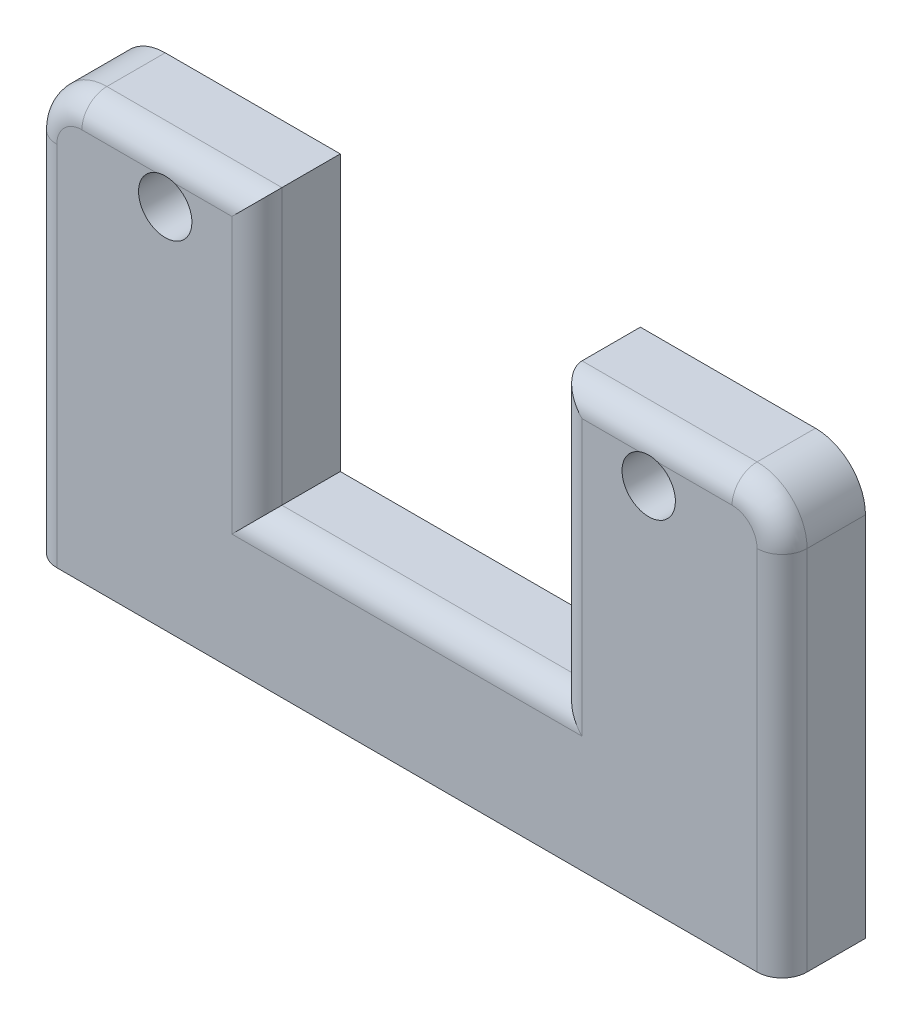
from build123d import *

# Parameters (mm, degrees)
MODEL_R             = 1.6
EXTRUDE_1_DEPTH     = 5
SKETCH_2_R          = 1.25
CUT_EXTRUDE_1_DEPTH = 6
FILLET_1_R          = 1.5


with BuildPart() as part:
    # Model → 凸台-拉伸1 (new body)
    with BuildSketch(Plane.XY):
        with BuildLine():
            Line((241.119901236, 237.095927438), (251.619901236, 237.095927438))
            Line((251.619901236, 237.095927438), (251.619901236, 220.595927438))
            Line((251.619901236, 220.595927438), (269.619901236, 220.595927438))
            Line((269.619901236, 220.595927438), (269.619901236, 237.095927438))
            Line((269.619901236, 237.095927438), (280.119901236, 237.095927438))
            ThreePointArc((280.119901236, 237.095927438), (282.241221579, 236.217247782), (283.119901236, 234.095927438))
            Line((283.119901236, 234.095927438), (283.119901236, 212.095927438))
            Line((283.119901236, 212.095927438), (238.119901236, 212.095927438))
            Line((238.119901236, 212.095927438), (238.119901236, 234.095927438))
            ThreePointArc((238.119901236, 234.095927438), (238.998580892, 236.217247782), (241.119901236, 237.095927438))
        make_face()
        with Locations((246.119901236, 234.095927438)):
            Circle(MODEL_R, mode=Mode.SUBTRACT)
        with Locations((275.119901236, 234.095927438)):
            Circle(MODEL_R, mode=Mode.SUBTRACT)
    extrude(amount=EXTRUDE_1_DEPTH)

    # 草图2 → 切除-拉伸1 (cut)
    with BuildSketch(Plane.XZ.offset(-212.095927438)):
        with Locations(Location((241.369901236, 2.5, 0), (0, 0, 270))):
            Circle(SKETCH_2_R)
        with Locations(Location((279.869901236, 2.5, 0), (0, 0, 270))):
            Circle(SKETCH_2_R)
    extrude(amount=-CUT_EXTRUDE_1_DEPTH, mode=Mode.SUBTRACT)

    # 圆角1
    # the kernel refuses this fillet: 1.5 mm, written as the material it takes off along each edge
    with BuildSketch(Plane(origin=(283.119901236, 234.095927438, 5), x_dir=(0, 0, -1), z_dir=(0, -1, 0))) as fillet_1_piece_1:
        with BuildLine():
            CenterArc((FILLET_1_R, -FILLET_1_R), FILLET_1_R, 90, 90)
            Line((0, -FILLET_1_R), (0, 0))
            Line((0, 0), (FILLET_1_R, 0))
        make_face()
    extrude(amount=25.75, mode=Mode.SUBTRACT)
    with BuildSketch(Plane(origin=(280.119901236, 234.095927438, 5), x_dir=(0, 1, 0), z_dir=(-1, 0, 0))) as fillet_1_piece_2:
        with BuildLine():
            CenterArc((3 - FILLET_1_R, FILLET_1_R), FILLET_1_R, 270, 90)
            Line((3 - FILLET_1_R, 0), (3, 0))
            Line((3, 0), (3, FILLET_1_R))
        make_face()
    revolve(axis=Axis((280.119901236, 234.095927438, 5), (0, 0, -1)), revolution_arc=90, mode=Mode.SUBTRACT)
    with BuildSketch(Plane(origin=(265.869901236, 237.095927438, 5), x_dir=(0, 0, -1), z_dir=(1, 0, 0))) as fillet_1_piece_3:
        with BuildLine():
            CenterArc((FILLET_1_R, -FILLET_1_R), FILLET_1_R, 90, 90)
            Line((0, -FILLET_1_R), (0, 0))
            Line((0, 0), (FILLET_1_R, 0))
        make_face()
    extrude(amount=14.25, mode=Mode.SUBTRACT)
    with BuildSketch(Plane(origin=(269.619901236, 220.595927438, 5), x_dir=(1, 0, 0), z_dir=(0, 1, 0)), Plane(origin=(251.619901236, 240.845927438, 5), x_dir=(-1, 0, 0), z_dir=(0, -1, 0))) as fillet_1_piece_4:
        with BuildLine():
            CenterArc((FILLET_1_R, FILLET_1_R), FILLET_1_R, 180, 90)
            Line((0, FILLET_1_R), (0, 0))
            Line((0, 0), (FILLET_1_R, 0))
        make_face()
    extrude(amount=20.25, mode=Mode.SUBTRACT)
    with BuildSketch(Plane(origin=(251.619901236, 220.595927438, 5), x_dir=(0, -1, 0), z_dir=(1, 0, 0))) as fillet_1_piece_5:
        with BuildLine():
            CenterArc((FILLET_1_R, FILLET_1_R), FILLET_1_R, 180, 90)
            Line((0, FILLET_1_R), (0, 0))
            Line((0, 0), (FILLET_1_R, 0))
        make_face()
    extrude(amount=18, mode=Mode.SUBTRACT)
    with BuildSketch(Plane(origin=(241.119901236, 237.095927438, 5), x_dir=(0, -1, 0), z_dir=(1, 0, 0))) as fillet_1_piece_6:
        with BuildLine():
            CenterArc((FILLET_1_R, FILLET_1_R), FILLET_1_R, 180, 90)
            Line((0, FILLET_1_R), (0, 0))
            Line((0, 0), (FILLET_1_R, 0))
        make_face()
    extrude(amount=14.25, mode=Mode.SUBTRACT)
    with BuildSketch(Plane(origin=(241.119901236, 234.095927438, 5), x_dir=(-1, 0, 0), z_dir=(0, -1, 0))) as fillet_1_piece_7:
        with BuildLine():
            CenterArc((3 - FILLET_1_R, FILLET_1_R), FILLET_1_R, 270, 90)
            Line((3, FILLET_1_R), (3, 0))
            Line((3, 0), (3 - FILLET_1_R, 0))
        make_face()
    revolve(axis=Axis((241.119901236, 234.095927438, 5), (0, 0, -1)), revolution_arc=90, mode=Mode.SUBTRACT)
    with BuildSketch(Plane(origin=(238.119901236, 208.345927438, 5), x_dir=(1, 0, 0), z_dir=(0, 1, 0))) as fillet_1_piece_8:
        with BuildLine():
            CenterArc((FILLET_1_R, FILLET_1_R), FILLET_1_R, 180, 90)
            Line((0, FILLET_1_R), (0, 0))
            Line((0, 0), (FILLET_1_R, 0))
        make_face()
    extrude(amount=25.75, mode=Mode.SUBTRACT)
    with BuildSketch(Plane(origin=(251.619901236, 220.595927438, 5), x_dir=(0, -1, 0), z_dir=(1, 0, 0))) as fillet_1_piece_9a_section:
        with BuildLine():
            CenterArc((FILLET_1_R, FILLET_1_R), FILLET_1_R, 180, 90)
            Line((0, FILLET_1_R), (0, 0))
            Line((0, 0), (FILLET_1_R, 0))
        make_face()
    fillet_1_piece_9a = extrude(amount=21.75, mode=Mode.PRIVATE)
    fillet_1_piece_9a = split(fillet_1_piece_9a, bisect_by=Plane(origin=(269.619901236, 220.256334767, 4.660407329), z_dir=(1, 0, 0)), keep=Keep.TOP, mode=Mode.PRIVATE)
    with BuildSketch(Plane(origin=(269.619901236, 216.845927438, 5), x_dir=(1, 0, 0), z_dir=(0, 1, 0))) as fillet_1_piece_9b_section:
        with BuildLine():
            CenterArc((FILLET_1_R, FILLET_1_R), FILLET_1_R, 180, 90)
            Line((0, FILLET_1_R), (0, 0))
            Line((0, 0), (FILLET_1_R, 0))
        make_face()
    fillet_1_piece_9b = extrude(amount=24, mode=Mode.PRIVATE)
    fillet_1_piece_9b = split(fillet_1_piece_9b, bisect_by=Plane(origin=(269.959493907, 220.595927438, 4.660407329), z_dir=(0, -1, 0)), keep=Keep.TOP, mode=Mode.PRIVATE)
    fillet_1_piece_9 = fillet_1_piece_9a & fillet_1_piece_9b
    add(fillet_1_piece_9, mode=Mode.SUBTRACT)
    with BuildSketch(Plane(origin=(251.619901236, 240.845927438, 5), x_dir=(-1, 0, 0), z_dir=(0, -1, 0))) as fillet_1_piece_10a_section:
        with BuildLine():
            CenterArc((FILLET_1_R, FILLET_1_R), FILLET_1_R, 180, 90)
            Line((0, FILLET_1_R), (0, 0))
            Line((0, 0), (FILLET_1_R, 0))
        make_face()
    fillet_1_piece_10a = extrude(amount=24, mode=Mode.PRIVATE)
    fillet_1_piece_10a = split(fillet_1_piece_10a, bisect_by=Plane(origin=(251.280308564, 220.595927438, 4.660407329), z_dir=(0, -1, 0)), keep=Keep.TOP, mode=Mode.PRIVATE)
    with BuildSketch(Plane(origin=(247.869901236, 220.595927438, 5), x_dir=(0, -1, 0), z_dir=(1, 0, 0))) as fillet_1_piece_10b_section:
        with BuildLine():
            CenterArc((FILLET_1_R, FILLET_1_R), FILLET_1_R, 180, 90)
            Line((0, FILLET_1_R), (0, 0))
            Line((0, 0), (FILLET_1_R, 0))
        make_face()
    fillet_1_piece_10b = extrude(amount=21.75, mode=Mode.PRIVATE)
    fillet_1_piece_10b = split(fillet_1_piece_10b, bisect_by=Plane(origin=(251.619901236, 220.256334767, 4.660407329), z_dir=(-1, 0, 0)), keep=Keep.TOP, mode=Mode.PRIVATE)
    fillet_1_piece_10 = fillet_1_piece_10a & fillet_1_piece_10b
    add(fillet_1_piece_10, mode=Mode.SUBTRACT)


solid = part.part
